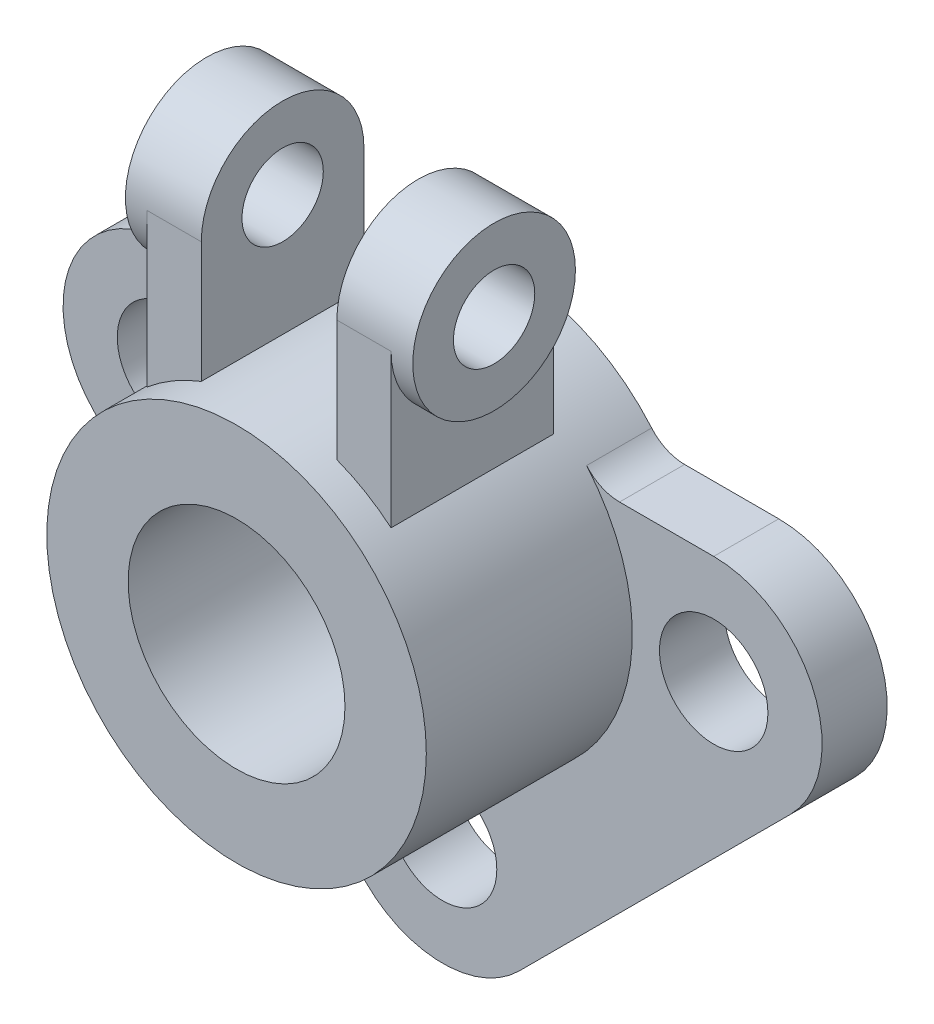
from build123d import *

# Parameters (mm, degrees)
SKETCH1_R                = 10
BOSS_EXTRUDE1_DEPTH      = 12
SKETCH1_3_R              = 35
SKETCH1_3_R_2            = 20
BOSS_EXTRUDE2_DEPTH      = 50
FILLET1_R                = 8
BOSS_EXTRUDE3_START      = 12.5
BOSS_EXTRUDE3_DEPTH      = 10
BOSS_EXTRUDE4_DEPTH      = 4
BOSS_EXTRUDE4_DEPTH_BACK = 10
SKETCH3_R                = 15
CUT_EXTRUDE1_REACH       = 131.276
SKETCH4_R                = 7.5


with BuildPart() as part:
    # Sketch1 → Boss-Extrude1 (new body)
    with BuildSketch(Plane.XY):
        with BuildLine():
            Line((-28.722813233, 20), (-50, 20))
            ThreePointArc((-50, 20), (-68.47759065, 7.653668647), (-64.142135624, -14.142135624))
            Line((-64.142135624, -14.142135624), (-14.142135624, -64.142135624))
            ThreePointArc((-14.142135624, -64.142135624), (0, -70), (14.142135624, -64.142135624))
            Line((14.142135624, -64.142135624), (64.142135624, -14.142135624))
            ThreePointArc((64.142135624, -14.142135624), (68.47759065, 7.653668647), (50, 20))
            Line((50, 20), (28.722813233, 20))
            ThreePointArc((28.722813233, 20), (33.393850206, 10.480971731), (35, 0))
            ThreePointArc((35, 0), (-10.480971731, -33.393850206), (-28.722813233, 20))
        make_face()
        with Locations((0, -50)):
            Circle(SKETCH1_R, mode=Mode.SUBTRACT)
        with Locations((-50, 0)):
            Circle(SKETCH1_R, mode=Mode.SUBTRACT)
        with Locations((50, 0)):
            Circle(SKETCH1_R, mode=Mode.SUBTRACT)
    extrude(amount=BOSS_EXTRUDE1_DEPTH)

    # Sketch1<3> → Boss-Extrude2 (add)
    with BuildSketch(Plane.XY):
        Circle(SKETCH1_3_R)
        Circle(SKETCH1_3_R_2, mode=Mode.SUBTRACT)
    extrude(amount=BOSS_EXTRUDE2_DEPTH)

    # Fillet1
    fillet1_edges = [part.edges().sort_by_distance(p)[0] for p in [
        (-28.722813233, 20, 6),
        (28.722813233, 20, 6),
    ]]
    fillet(fillet1_edges, radius=FILLET1_R)

    # Sketch2 → Boss-Extrude3 (add)
    with BuildSketch(Plane(origin=(0, 0, 0), x_dir=(0, 0, -1), z_dir=(1, 0, 0)).offset(BOSS_EXTRUDE3_START)):
        Polygon((-44, 35), (-44, 20.954401211), (-14, 20.954401211), (-14, 55), (-44, 55), align=None)
    extrude(amount=BOSS_EXTRUDE3_DEPTH)

    # Sketch3 → Boss-Extrude4 (add, two sides: drawn at the far end of the back side and taken through both)
    with BuildSketch(Plane(origin=(22.5, 0, 0), x_dir=(0, 0, -1), z_dir=(1, 0, 0)).offset(-BOSS_EXTRUDE4_DEPTH_BACK)):
        with Locations((-29, 55)):
            Circle(SKETCH3_R)
    extrude(amount=BOSS_EXTRUDE4_DEPTH + BOSS_EXTRUDE4_DEPTH_BACK)

    # Sketch4 → Cut-Extrude1 (cut, up to next)
    with BuildSketch(Plane(origin=(26.5, 0, 0), x_dir=(0, 0, -1), z_dir=(1, 0, 0)), mode=Mode.PRIVATE) as cut_extrude1_sk1:
        with Locations((-29, 55)):
            Circle(SKETCH4_R)
    cut_extrude1_tool1 = extrude(cut_extrude1_sk1.sketch, amount=-CUT_EXTRUDE1_REACH, mode=Mode.PRIVATE) & part.part
    add(cut_extrude1_tool1.solids().sort_by_distance((26.5, 55, 29))[0], mode=Mode.SUBTRACT)

    # Mirror1: part across plane


with BuildPart() as part_1:
    add(part.part)
    add(part.part.mirror(Plane(origin=(0, 0, 0), x_dir=(0, 0, 1), z_dir=(1, 0, 0))))


solid = part_1.part
